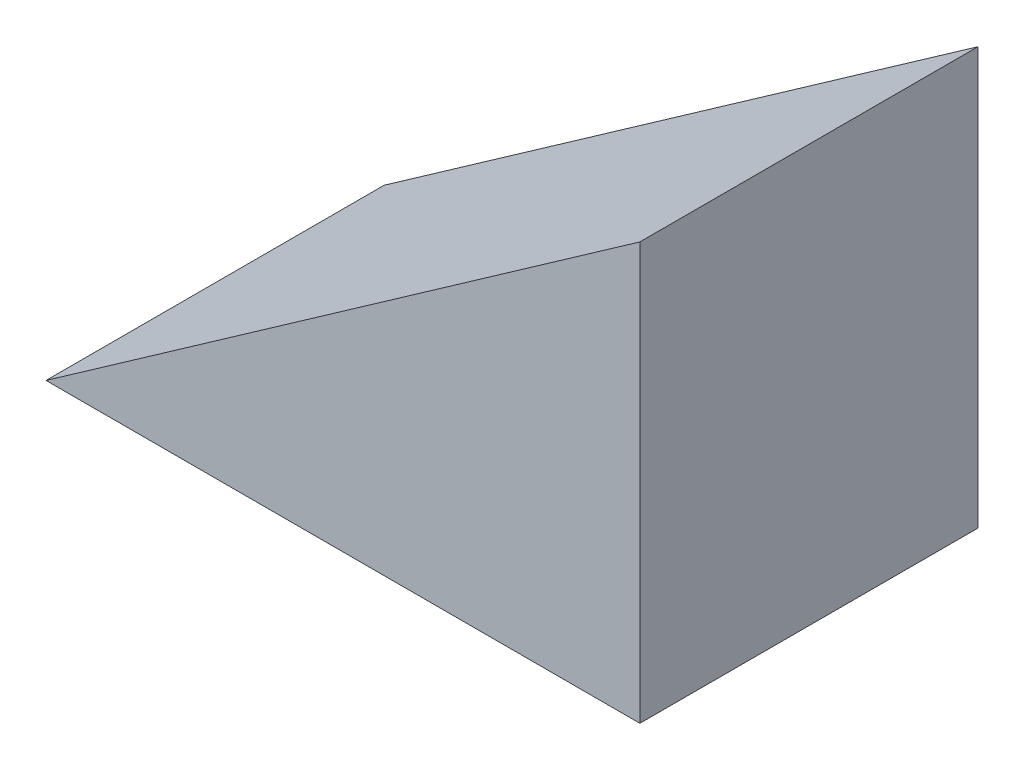
from build123d import *

# Parameters (mm, degrees)
SKETCH1_W           = 104.5
SKETCH1_H           = 59.5
BOSS_EXTRUDE1_DEPTH = 73.36
CUT_EXTRUDE2_DEPTH  = 108.944439875


with BuildPart() as part:
    # Sketch1 → Boss-Extrude1 (new body)
    with BuildSketch(Plane(origin=(0, 0, 0), x_dir=(1, 0, 0), z_dir=(0, 1, 0))):
        Rectangle(SKETCH1_W, SKETCH1_H)
    extrude(amount=BOSS_EXTRUDE1_DEPTH)

    # Sketch6 → Cut-Extrude2 (cut, through all)
    with BuildSketch(Plane.XY.offset(29.75)):
        Polygon((-52.25, 0), (52.25, 73.36), (-52.25, 73.36), align=None)
    extrude(amount=-CUT_EXTRUDE2_DEPTH, mode=Mode.SUBTRACT)


solid = part.part
